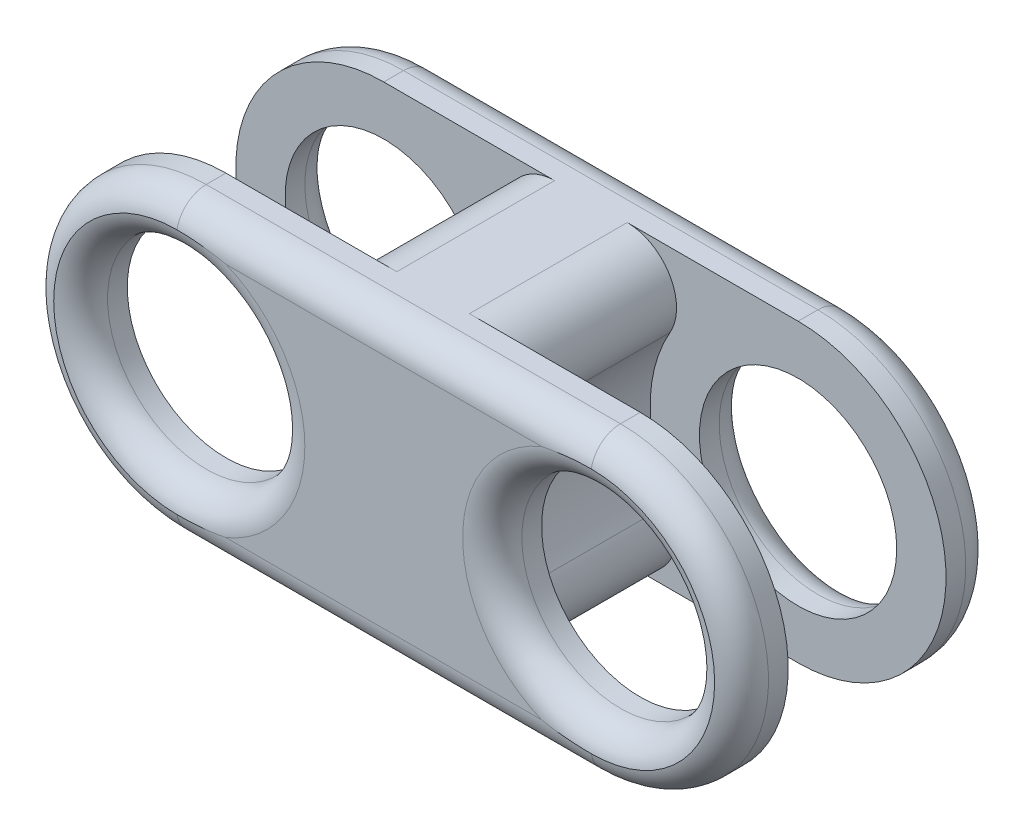
from build123d import *

# Parameters (mm, degrees)
BOSS_EXTRUDE2_DEPTH      = 6.5
BOSS_EXTRUDE2_DEPTH_BACK = 6.5
SKETCH1_R                = 7.5
CUT_EXTRUDE1_DEPTH       = 4
CUT_EXTRUDE1_DEPTH_BACK  = 4
SKETCH2_R                = 7.5
FILLET1_START            = -4
FILLET1_DEPTH            = 8
SKETCH3_R                = 5
CUT_EXTRUDE2_DEPTH       = 16
FILLET2_R                = 1.5


with BuildPart() as part:
    # Sketch1 → Boss-Extrude2 (new, two sides: drawn at the far end of the back side and taken through both)
    with BuildSketch(Plane.XY.offset(-BOSS_EXTRUDE2_DEPTH_BACK)):
        with Locations((-21, 0)):
            Circle(SKETCH1_R)
        with BuildLine():
            Line((0, 7.5), (-21, 7.5))
            ThreePointArc((-21, 7.5), (-15.696699141, 5.303300859), (-13.5, 0))
            ThreePointArc((-13.5, 0), (-15.696699141, -5.303300859), (-21, -7.5))
            Line((-21, -7.5), (0, -7.5))
            ThreePointArc((0, -7.5), (-7.5, 0), (0, 7.5))
        make_face()
        Circle(SKETCH1_R)
    extrude(amount=BOSS_EXTRUDE2_DEPTH + BOSS_EXTRUDE2_DEPTH_BACK)

    # Sketch2 → Cut-Extrude1 (cut, two sides: drawn at the far end of the back side and taken through both)
    with BuildSketch(Plane.XY.offset(-CUT_EXTRUDE1_DEPTH_BACK)):
        with Locations((-21, 0)):
            Circle(SKETCH2_R)
        Circle(SKETCH2_R)
    extrude(amount=CUT_EXTRUDE1_DEPTH + CUT_EXTRUDE1_DEPTH_BACK, mode=Mode.SUBTRACT)

    # Fillet1: read off the stored shape, not the designer's step
    # Fillet1 outline → Fillet1 (cut)
    with BuildSketch(Plane.XY.offset(FILLET1_START)):
        with BuildLine():
            ThreePointArc((0, -7.5), (-3.75, -6.495190528), (-6.495190528, -3.75))
            ThreePointArc((-6.495190528, -3.75), (-6.495190528, -6.25), (-8.660254038, -7.5))
            Line((-8.660254038, -7.5), (0, -7.5))
        make_face()
        with BuildLine():
            ThreePointArc((-8.660254038, 7.5), (-6.495190528, 6.25), (-6.495190528, 3.75))
            ThreePointArc((-6.495190528, 3.75), (-3.75, 6.495190528), (0, 7.5))
            Line((0, 7.5), (-8.660254038, 7.5))
        make_face()
        with BuildLine():
            Line((-21, -7.5), (-12.339745962, -7.5))
            ThreePointArc((-12.339745962, -7.5), (-14.504809472, -6.25), (-14.504809472, -3.75))
            ThreePointArc((-14.504809472, -3.75), (-17.25, -6.495190528), (-21, -7.5))
        make_face()
        with BuildLine():
            ThreePointArc((-14.504809472, 3.75), (-14.504809472, 6.25), (-12.339745962, 7.5))
            Line((-12.339745962, 7.5), (-21, 7.5))
            ThreePointArc((-21, 7.5), (-17.25, 6.495190528), (-14.504809472, 3.75))
        make_face()
    extrude(amount=FILLET1_DEPTH, mode=Mode.SUBTRACT)

    # Sketch3 → Cut-Extrude2 (cut)
    with BuildSketch(Plane.XY.offset(6.5)):
        with Locations((-21, 0)):
            Circle(SKETCH3_R)
        Circle(SKETCH3_R)
    extrude(amount=-CUT_EXTRUDE2_DEPTH, mode=Mode.SUBTRACT)

    # Fillet2
    # the kernel refuses this fillet: 1.5 mm, written as the material it takes off along each edge
    with BuildSketch(Plane(origin=(-21, 0, -6.5), x_dir=(1, 0, 0), z_dir=(0, -1, 0))) as fillet2_piece_1:
        with BuildLine():
            CenterArc((5 + FILLET2_R, FILLET2_R), FILLET2_R, 180, 90)
            Line((5, FILLET2_R), (5, 0))
            Line((5, 0), (5 + FILLET2_R, 0))
        make_face()
    revolve(axis=Axis((-21, 0, -6.5), (0, 0, 1)), mode=Mode.SUBTRACT)
    with BuildSketch(Plane(origin=(-21, 0, 6.5), x_dir=(1, 0, 0), z_dir=(0, -1, 0))) as fillet2_piece_2:
        with BuildLine():
            CenterArc((5 + FILLET2_R, -FILLET2_R), FILLET2_R, 90, 90)
            Line((5, -FILLET2_R), (5, 0))
            Line((5, 0), (5 + FILLET2_R, 0))
        make_face()
    revolve(axis=Axis((-21, 0, 6.5), (0, 0, 1)), mode=Mode.SUBTRACT)
    with BuildSketch(Plane(origin=(0, 0, -6.5), x_dir=(1, 0, 0), z_dir=(0, -1, 0))) as fillet2_piece_3:
        with BuildLine():
            CenterArc((5 + FILLET2_R, FILLET2_R), FILLET2_R, 180, 90)
            Line((5, FILLET2_R), (5, 0))
            Line((5, 0), (5 + FILLET2_R, 0))
        make_face()
    revolve(axis=Axis((0, 0, -6.5), (0, 0, 1)), mode=Mode.SUBTRACT)
    with BuildSketch(Plane(origin=(0, 0, 6.5), x_dir=(1, 0, 0), z_dir=(0, -1, 0))) as fillet2_piece_4:
        with BuildLine():
            CenterArc((5 + FILLET2_R, -FILLET2_R), FILLET2_R, 90, 90)
            Line((5, -FILLET2_R), (5, 0))
            Line((5, 0), (5 + FILLET2_R, 0))
        make_face()
    revolve(axis=Axis((0, 0, 6.5), (0, 0, 1)), mode=Mode.SUBTRACT)
    with BuildSketch(Plane(origin=(0, 7.5, 6.5), x_dir=(0, -1, 0), z_dir=(-1, 0, 0)), Plane(origin=(-21, -7.5, -6.5), x_dir=(0, 0, 1), z_dir=(1, 0, 0)), Plane(origin=(0, 7.5, -6.5), x_dir=(0, 0, 1), z_dir=(-1, 0, 0))) as fillet2_piece_5:
        with BuildLine():
            CenterArc((FILLET2_R, -FILLET2_R), FILLET2_R, 90, 90)
            Line((0, -FILLET2_R), (0, 0))
            Line((0, 0), (FILLET2_R, 0))
        make_face()
    extrude(amount=21, mode=Mode.SUBTRACT)
    with BuildSketch(Plane(origin=(-21, 0, 6.5), x_dir=(0, 1, 0), z_dir=(1, 0, 0))) as fillet2_piece_6:
        with BuildLine():
            CenterArc((7.5 - FILLET2_R, -FILLET2_R), FILLET2_R, 0, 90)
            Line((7.5, -FILLET2_R), (7.5, 0))
            Line((7.5, 0), (7.5 - FILLET2_R, 0))
        make_face()
    revolve(axis=Axis((-21, 0, 6.5), (0, 0, 1)), revolution_arc=180, mode=Mode.SUBTRACT)
    with BuildSketch(Plane(origin=(-21, -7.5, 6.5), x_dir=(0, 0, -1), z_dir=(1, 0, 0))) as fillet2_piece_7:
        with BuildLine():
            CenterArc((FILLET2_R, FILLET2_R), FILLET2_R, 180, 90)
            Line((0, FILLET2_R), (0, 0))
            Line((0, 0), (FILLET2_R, 0))
        make_face()
    extrude(amount=21, mode=Mode.SUBTRACT)
    with BuildSketch(Plane(origin=(0, 0, 6.5), x_dir=(0, 1, 0), z_dir=(-1, 0, 0))) as fillet2_piece_8:
        with BuildLine():
            CenterArc((7.5 - FILLET2_R, FILLET2_R), FILLET2_R, 270, 90)
            Line((7.5 - FILLET2_R, 0), (7.5, 0))
            Line((7.5, 0), (7.5, FILLET2_R))
        make_face()
    revolve(axis=Axis((0, 0, 6.5), (0, 0, -1)), revolution_arc=180, mode=Mode.SUBTRACT)
    with BuildSketch(Plane(origin=(0, 0, -6.5), x_dir=(0, -1, 0), z_dir=(-1, 0, 0))) as fillet2_piece_9:
        with BuildLine():
            CenterArc((7.5 - FILLET2_R, FILLET2_R), FILLET2_R, 270, 90)
            Line((7.5, FILLET2_R), (7.5, 0))
            Line((7.5, 0), (7.5 - FILLET2_R, 0))
        make_face()
    revolve(axis=Axis((0, 0, -6.5), (0, 0, 1)), revolution_arc=180, mode=Mode.SUBTRACT)
    with BuildSketch(Plane(origin=(-21, 0, -6.5), x_dir=(0, 1, 0), z_dir=(1, 0, 0))) as fillet2_piece_10:
        with BuildLine():
            CenterArc((7.5 - FILLET2_R, FILLET2_R), FILLET2_R, 270, 90)
            Line((7.5 - FILLET2_R, 0), (7.5, 0))
            Line((7.5, 0), (7.5, FILLET2_R))
        make_face()
    revolve(axis=Axis((-21, 0, -6.5), (0, 0, 1)), revolution_arc=180, mode=Mode.SUBTRACT)


solid = part.part
